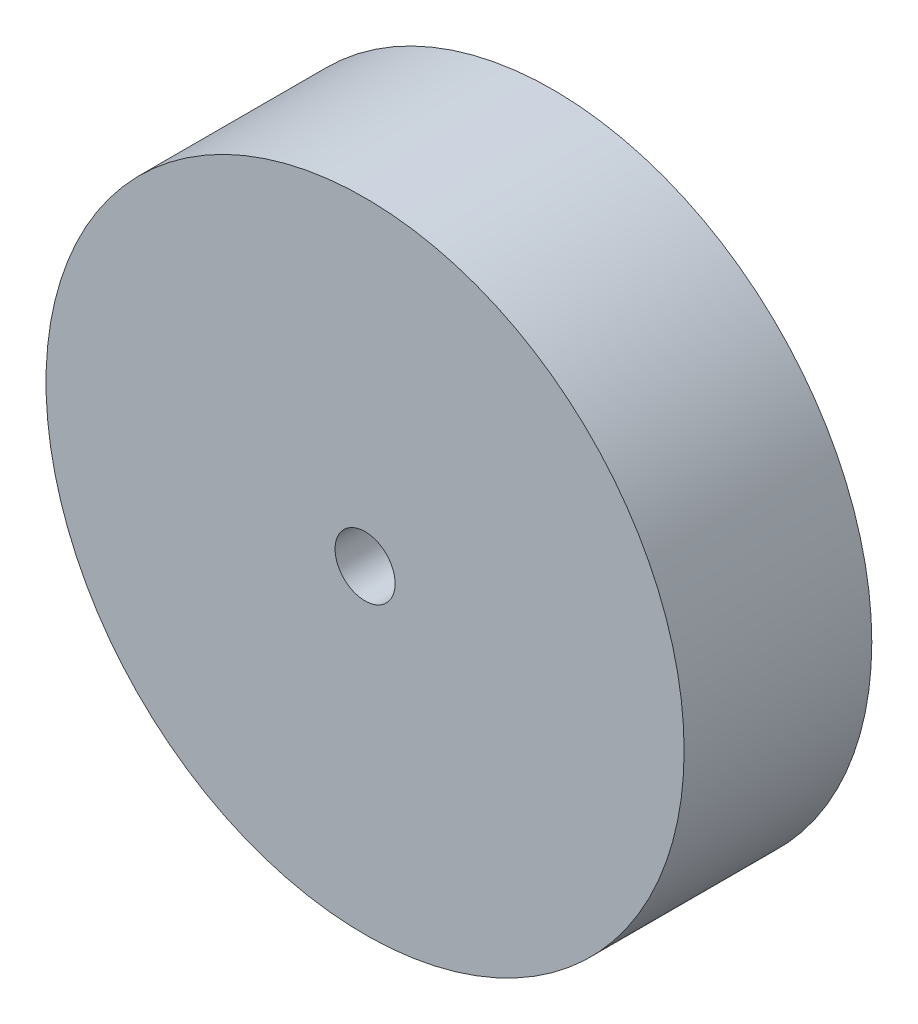
from build123d import *

# Parameters (mm, degrees)
SKETCH1_R           = 17
SKETCH1_R_2         = 1.6
BOSS_EXTRUDE1_DEPTH = 10


with BuildPart() as part:
    # Sketch1 → Boss-Extrude1 (new body)
    with BuildSketch(Plane.XY):
        Circle(SKETCH1_R)
        Circle(SKETCH1_R_2, mode=Mode.SUBTRACT)
    extrude(amount=BOSS_EXTRUDE1_DEPTH)


solid = part.part
